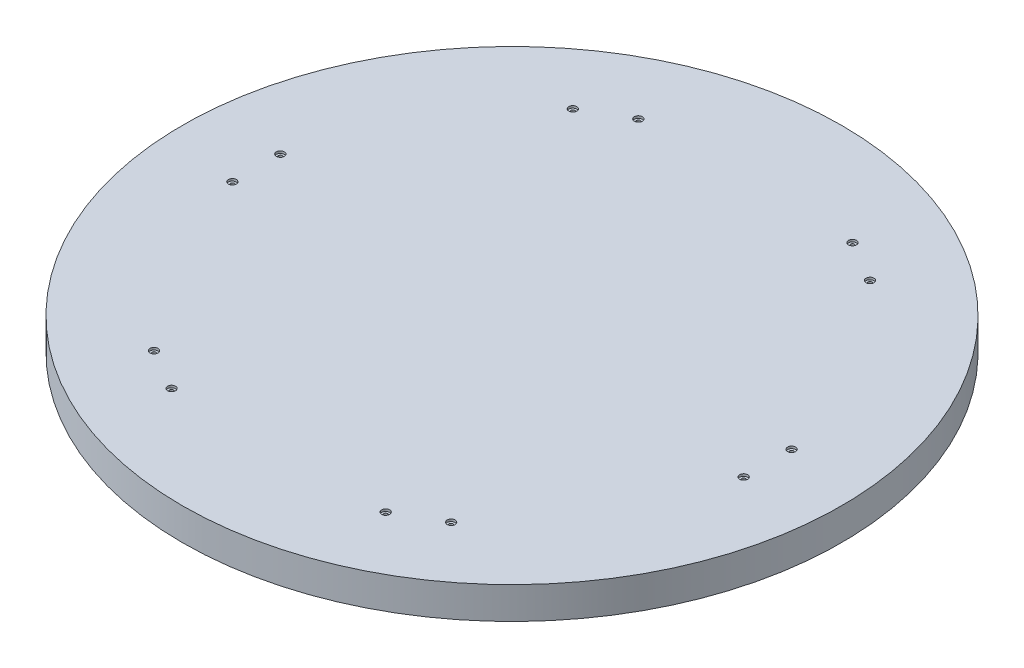
from build123d import *

# Parameters (mm, degrees)
SKETCH1_R           = 261.9375
BOSS_EXTRUDE1_DEPTH = 25.4
CUT_EXTRUDE4_DEPTH  = 12.7
SKETCH7_R           = 1.524
CUT_EXTRUDE5_DEPTH  = 371.653204239
SKETCH8_R           = 3.175
CUT_EXTRUDE6_DEPTH  = 1.778
SKETCH9_R           = 25.4
BOSS_EXTRUDE2_DEPTH = 10.16
CUT_EXTRUDE7_DEPTH  = 19.05


with BuildPart() as part:
    # Sketch1 → Boss-Extrude1 (new body)
    with BuildSketch(Plane(origin=(0, 0, 0), x_dir=(1, 0, 0), z_dir=(0, 1, 0))):
        Circle(SKETCH1_R)
    extrude(amount=BOSS_EXTRUDE1_DEPTH)

    # Sketch6 → Cut-Extrude4 (cut)
    with BuildSketch(Plane.XZ):
        with BuildLine():
            Line((215.9, 19.05), (215.9, -19.05))
            ThreePointArc((215.9, -19.05), (203.2, -31.75), (190.5, -19.05))
            Line((190.5, -19.05), (190.5, 19.05))
            ThreePointArc((190.5, 19.05), (203.2, 31.75), (215.9, 19.05))
        make_face()
        with BuildLine():
            Line((124.447783942, -177.449884677), (91.452216058, -196.499884677))
            ThreePointArc((91.452216058, -196.499884677), (74.10369343, -191.851362049), (78.752216058, -174.502839421))
            Line((78.752216058, -174.502839421), (111.747783942, -155.452839421))
            ThreePointArc((111.747783942, -155.452839421), (129.09630657, -160.101362049), (124.447783942, -177.449884677))
        make_face()
        with BuildLine():
            Line((-91.452216058, -196.499884677), (-124.447783942, -177.449884677))
            ThreePointArc((-124.447783942, -177.449884677), (-129.09630657, -160.101362049), (-111.747783942, -155.452839421))
            Line((-111.747783942, -155.452839421), (-78.752216058, -174.502839421))
            ThreePointArc((-78.752216058, -174.502839421), (-74.10369343, -191.851362049), (-91.452216058, -196.499884677))
        make_face()
        with BuildLine():
            Line((-215.9, -19.05), (-215.9, 19.05))
            ThreePointArc((-215.9, 19.05), (-203.2, 31.75), (-190.5, 19.05))
            Line((-190.5, 19.05), (-190.5, -19.05))
            ThreePointArc((-190.5, -19.05), (-203.2, -31.75), (-215.9, -19.05))
        make_face()
        with BuildLine():
            Line((-124.447783942, 177.449884677), (-91.452216058, 196.499884677))
            ThreePointArc((-91.452216058, 196.499884677), (-74.10369343, 191.851362049), (-78.752216058, 174.502839421))
            Line((-78.752216058, 174.502839421), (-111.747783942, 155.452839421))
            ThreePointArc((-111.747783942, 155.452839421), (-129.09630657, 160.101362049), (-124.447783942, 177.449884677))
        make_face()
        with BuildLine():
            Line((91.452216058, 196.499884677), (124.447783942, 177.449884677))
            ThreePointArc((124.447783942, 177.449884677), (129.09630657, 160.101362049), (111.747783942, 155.452839421))
            Line((111.747783942, 155.452839421), (78.752216058, 174.502839421))
            ThreePointArc((78.752216058, 174.502839421), (74.10369343, 191.851362049), (91.452216058, 196.499884677))
        make_face()
    extrude(amount=-CUT_EXTRUDE4_DEPTH, mode=Mode.SUBTRACT)

    # Sketch7 → Cut-Extrude5 (cut, through all)
    with BuildSketch(Plane.XZ.offset(-12.7)):
        with Locations((203.2, -19.05)):
            Circle(SKETCH7_R)
        with Locations((203.2, 19.05)):
            Circle(SKETCH7_R)
        with Locations((85.102215311, -185.50136223)):
            Circle(SKETCH7_R)
        with Locations((118.097783195, -166.45136223)):
            Circle(SKETCH7_R)
        with Locations((-118.097785219, -166.451361674)):
            Circle(SKETCH7_R)
        with Locations((-85.102217335, -185.501361674)):
            Circle(SKETCH7_R)
        with Locations((-203.20000106, 19.050001113)):
            Circle(SKETCH7_R)
        with Locations((-203.20000106, -19.049998887)):
            Circle(SKETCH7_R)
        with Locations((-85.102216371, 185.501363343)):
            Circle(SKETCH7_R)
        with Locations((-118.097784256, 166.451363343)):
            Circle(SKETCH7_R)
        with Locations((118.097784159, 166.451362786)):
            Circle(SKETCH7_R)
        with Locations((85.102216275, 185.501362786)):
            Circle(SKETCH7_R)
    extrude(amount=-CUT_EXTRUDE5_DEPTH, mode=Mode.SUBTRACT)

    # Sketch8 → Cut-Extrude6 (cut)
    with BuildSketch(Plane(origin=(0, 25.4, 0), x_dir=(1, 0, 0), z_dir=(0, 1, 0))):
        with Locations((-203.200001277, -19.050000375)):
            Circle(SKETCH8_R)
        with Locations((-203.200001277, 19.049999625)):
            Circle(SKETCH8_R)
        with Locations((-118.097784906, 166.451362967)):
            Circle(SKETCH8_R)
        with Locations((-85.102217021, 185.501362967)):
            Circle(SKETCH8_R)
        with Locations((-85.102216371, -185.501363343)):
            Circle(SKETCH8_R)
        with Locations((-118.097784256, -166.451363343)):
            Circle(SKETCH8_R)
        with Locations((85.102216371, 185.501363343)):
            Circle(SKETCH8_R)
        with Locations((118.097784256, 166.451363343)):
            Circle(SKETCH8_R)
        with Locations((203.200001277, 19.050000375)):
            Circle(SKETCH8_R)
        with Locations((203.200001277, -19.049999625)):
            Circle(SKETCH8_R)
        with Locations((118.097784906, -166.451362967)):
            Circle(SKETCH8_R)
        with Locations((85.102217021, -185.501362967)):
            Circle(SKETCH8_R)
    extrude(amount=-CUT_EXTRUDE6_DEPTH, mode=Mode.SUBTRACT)

    # Sketch9 → Boss-Extrude2 (add)
    with BuildSketch(Plane.XZ):
        Circle(SKETCH9_R)
    extrude(amount=BOSS_EXTRUDE2_DEPTH)

    # Sketch10 → Cut-Extrude7 (cut)
    with BuildSketch(Plane.XZ.offset(10.16)):
        with BuildLine():
            Line((-1.344041666, 1.524), (1.344041666, 1.524))
            ThreePointArc((1.344041666, 1.524), (0, -2.032), (-1.344041666, 1.524))
        make_face()
    extrude(amount=-CUT_EXTRUDE7_DEPTH, mode=Mode.SUBTRACT)


solid = part.part
